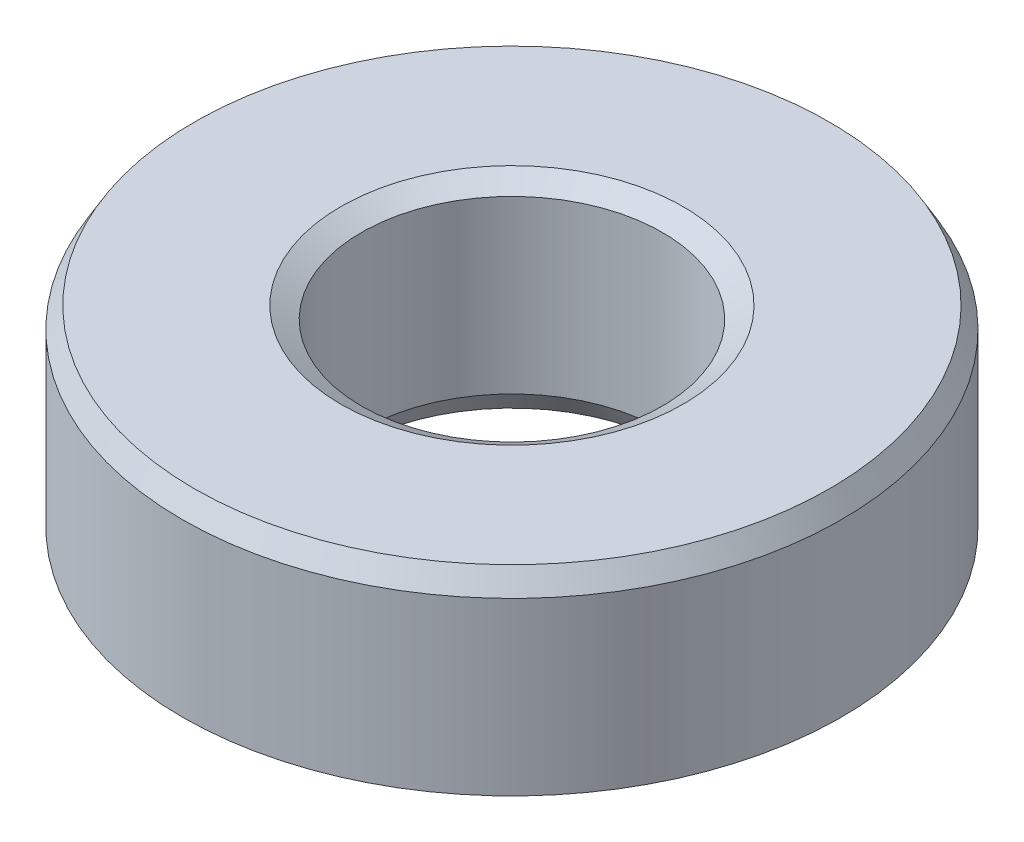
from build123d import *
from OCP.BRepFilletAPI import BRepFilletAPI_MakeChamfer

# Parameters (mm, degrees)
SKETCH1_R           = 20
BOSS_EXTRUDE1_DEPTH = 12.367771983
SKETCH2_R           = 9.130294097
CUT_EXTRUDE1_DEPTH  = 31.870079103
CHAMFER1_SIZE       = 1.258897916
CHAMFER1_SIZE2      = 0.726825051


with BuildPart() as part:
    # Sketch1 → Boss-Extrude1 (new body)
    with BuildSketch(Plane(origin=(0, 0, 0), x_dir=(1, 0, 0), z_dir=(0, 1, 0))):
        Circle(SKETCH1_R)
    extrude(amount=BOSS_EXTRUDE1_DEPTH)

    # Sketch2 → Cut-Extrude1 (cut, through all)
    with BuildSketch(Plane(origin=(0, 0, 0), x_dir=(1, 0, 0), z_dir=(0, 1, 0))):
        Circle(SKETCH2_R)
    extrude(amount=CUT_EXTRUDE1_DEPTH, mode=Mode.SUBTRACT)

    # Chamfer1: one chamfer whose edges measure the first distance from different faces: ONE call of the kernel's chamfer builder (chamfer() names one face for all edges)
    chamfer1_edges_1 = [part.edges().sort_by_distance(p)[0] for p in [
        (-9.130294097, 12.367771983, 0),
    ]]
    chamfer1_side_1 = [part.faces().sort_by_distance(p)[0] for p in [
        (-19.434314575, 12.367771983, 0),
    ]]
    chamfer1_edges_2 = [part.edges().sort_by_distance(p)[0] for p in [
        (-9.130294097, 0, 0),
    ]]
    chamfer1_side_2 = [part.faces().sort_by_distance(p)[0] for p in [
        (-9.130294097, 6.183885992, 0),
    ]]
    chamfer1_edges_3 = [part.edges().sort_by_distance(p)[0] for p in [
        (-20, 0, 0),
    ]]
    chamfer1_side_3 = [part.faces().sort_by_distance(p)[0] for p in [
        (-19.434314575, 0, 0),
    ]]
    chamfer1_edges_4 = [part.edges().sort_by_distance(p)[0] for p in [
        (-20, 12.367771983, 0),
    ]]
    chamfer1_side_4 = [part.faces().sort_by_distance(p)[0] for p in [
        (-20, 6.183885992, 0),
    ]]
    chamfer1 = BRepFilletAPI_MakeChamfer(part.part.solid().wrapped)
    for e in chamfer1_edges_1:
        chamfer1.Add(CHAMFER1_SIZE, CHAMFER1_SIZE2, e.wrapped, chamfer1_side_1[0].wrapped)  # the first distance lies on this face
    for e in chamfer1_edges_2:
        chamfer1.Add(CHAMFER1_SIZE, CHAMFER1_SIZE2, e.wrapped, chamfer1_side_2[0].wrapped)  # the first distance lies on this face
    for e in chamfer1_edges_3:
        chamfer1.Add(CHAMFER1_SIZE, CHAMFER1_SIZE2, e.wrapped, chamfer1_side_3[0].wrapped)  # the first distance lies on this face
    for e in chamfer1_edges_4:
        chamfer1.Add(CHAMFER1_SIZE, CHAMFER1_SIZE2, e.wrapped, chamfer1_side_4[0].wrapped)  # the first distance lies on this face
    add(Compound.cast(chamfer1.Shape()), mode=Mode.REPLACE)


solid = part.part
